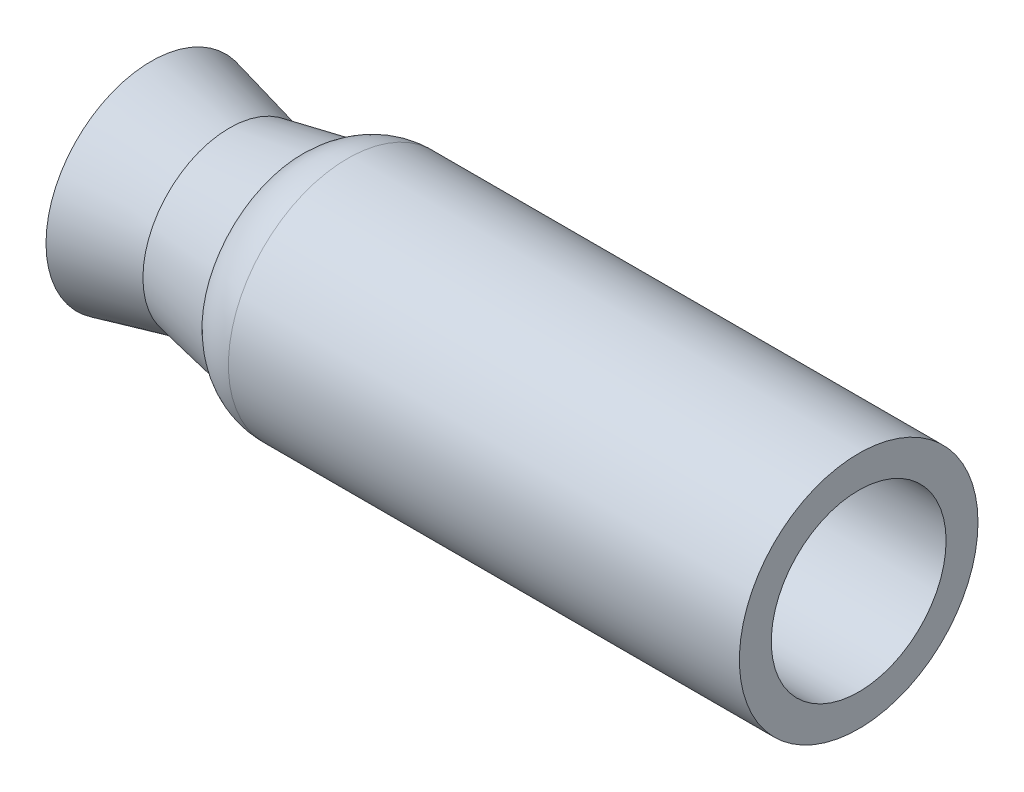
from build123d import *


with BuildPart() as part:
    # Sketch1 → Revolve1 (revolve)
    with BuildSketch(Plane.XY):
        with BuildLine():
            Line((-107.862323025, 27.400944548), (52.322643444, 27.400944548))
            Line((52.322643444, 27.400944548), (52.322643444, 37.400944548))
            Line((52.322643444, 37.400944548), (-107.862323025, 37.400944548))
            ThreePointArc((-107.862323025, 37.400944548), (-115.515991673, 35.878535198), (-122.004458649, 31.543080172))
            Line((-122.004458649, 31.543080172), (-144.933390837, 27.131544172))
            Line((-144.933390837, 27.131544172), (-169.474152094, 32.976348099))
            Line((-169.474152094, 32.976348099), (-171.933390837, 23.283456642))
            add(Edge.make_bspline(
                [(-171.933390837, 23.283456642), (-158.435473315, 19.858823042), (-144.933390837, 14.7)],
                knots=[0, 0, 0, 1, 1, 1], degree=2))
            Line((-144.933390837, 14.7), (-143.633390837, 14.210120538))
            Line((-143.633390837, 14.210120538), (-143.633390837, 18.950120538))
            Line((-143.633390837, 18.950120538), (-114.933390837, 24.47201236))
            ThreePointArc((-114.933390837, 24.47201236), (-111.689157349, 26.639739873), (-107.862323025, 27.400944548))
        make_face()
    revolve(axis=Axis((0, 0, 0), (-1, 0, 0)))


solid = part.part
